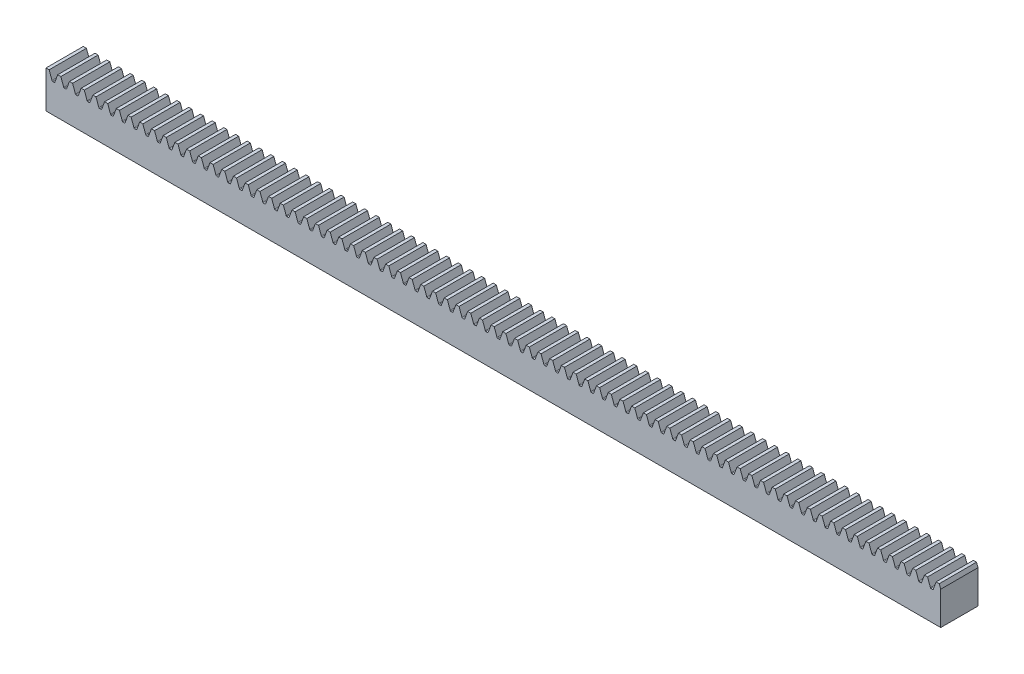
from build123d import *

# Parameters (mm, degrees)
SKETCH1_W           = 304.8
SKETCH1_H           = 12.7
BOSS_EXTRUDE1_DEPTH = 6.35
CUT_EXTRUDE1_DEPTH  = 12.7
FILLET3_R           = 0.254566605
LPATTERN4_START     = -6.35
LPATTERN4_DEPTH     = 12.7


# Read off the part's stored shape, not the designer's step: LPattern4
with BuildPart() as part:
    # Sketch1 → Boss-Extrude1 (new, symmetric)
    with BuildSketch(Plane.XY):
        Rectangle(SKETCH1_W, SKETCH1_H)
    extrude(amount=BOSS_EXTRUDE1_DEPTH, both=True)

    # Sketch2 → Cut-Extrude1 (cut)
    with BuildSketch(Plane.XY.offset(6.35)):
        Polygon((-151.329568395, 6.35), (-150.294145873, 3.5052), (-149.445590522, 3.5052), (-148.410168, 6.35), align=None)
    extrude(amount=-CUT_EXTRUDE1_DEPTH, mode=Mode.SUBTRACT)

    # Fillet3
    fillet3_edges = [part.edges().sort_by_distance(p)[0] for p in [
        (-149.445590522, 3.5052, 0),
        (-150.294145873, 3.5052, 0),
    ]]
    fillet(fillet3_edges, radius=FILLET3_R)

    # LPattern4 outline → LPattern4 (cut)
    with BuildSketch(Plane.XY.offset(LPATTERN4_START)):
        with BuildLine():
            ThreePointArc((-146.365278777, 3.672699698), (-146.272077823, 3.55123785), (-146.126064417, 3.5052))
            Line((-146.126064417, 3.5052), (-145.634007978, 3.5052))
            ThreePointArc((-145.634007978, 3.5052), (-145.487994572, 3.55123785), (-145.394793618, 3.672699698))
            Line((-145.394793618, 3.672699698), (-144.420336, 6.35))
            Line((-144.420336, 6.35), (-147.339736395, 6.35))
            Line((-147.339736395, 6.35), (-146.365278777, 3.672699698))
        make_face()
        Polygon((152.4, 6.35), (151.897663605, 6.35), (152.4, 4.969842098), align=None)
        with BuildLine():
            Line((150.827232, 6.35), (147.907831605, 6.35))
            Line((147.907831605, 6.35), (148.882289223, 3.672699698))
            ThreePointArc((148.882289223, 3.672699698), (148.975490177, 3.55123785), (149.121503583, 3.5052))
            Line((149.121503583, 3.5052), (149.613560022, 3.5052))
            ThreePointArc((149.613560022, 3.5052), (149.759573428, 3.55123785), (149.852774382, 3.672699698))
            Line((149.852774382, 3.672699698), (150.827232, 6.35))
        make_face()
        with BuildLine():
            Line((146.8374, 6.35), (143.917999605, 6.35))
            Line((143.917999605, 6.35), (144.892457223, 3.672699698))
            ThreePointArc((144.892457223, 3.672699698), (144.985658177, 3.55123785), (145.131671583, 3.5052))
            Line((145.131671583, 3.5052), (145.623728022, 3.5052))
            ThreePointArc((145.623728022, 3.5052), (145.769741428, 3.55123785), (145.862942382, 3.672699698))
            Line((145.862942382, 3.672699698), (146.8374, 6.35))
        make_face()
        with BuildLine():
            Line((142.847568, 6.35), (139.928167605, 6.35))
            Line((139.928167605, 6.35), (140.902625223, 3.672699698))
            ThreePointArc((140.902625223, 3.672699698), (140.995826177, 3.55123785), (141.141839583, 3.5052))
            Line((141.141839583, 3.5052), (141.633896022, 3.5052))
            ThreePointArc((141.633896022, 3.5052), (141.779909428, 3.55123785), (141.873110382, 3.672699698))
            Line((141.873110382, 3.672699698), (142.847568, 6.35))
        make_face()
        with BuildLine():
            Line((138.857736, 6.35), (135.938335605, 6.35))
            Line((135.938335605, 6.35), (136.912793223, 3.672699698))
            ThreePointArc((136.912793223, 3.672699698), (137.005994177, 3.55123785), (137.152007583, 3.5052))
            Line((137.152007583, 3.5052), (137.644064022, 3.5052))
            ThreePointArc((137.644064022, 3.5052), (137.790077428, 3.55123785), (137.883278382, 3.672699698))
            Line((137.883278382, 3.672699698), (138.857736, 6.35))
        make_face()
        with BuildLine():
            Line((134.867904, 6.35), (131.948503605, 6.35))
            Line((131.948503605, 6.35), (132.922961223, 3.672699698))
            ThreePointArc((132.922961223, 3.672699698), (133.016162177, 3.55123785), (133.162175583, 3.5052))
            Line((133.162175583, 3.5052), (133.654232022, 3.5052))
            ThreePointArc((133.654232022, 3.5052), (133.800245428, 3.55123785), (133.893446382, 3.672699698))
            Line((133.893446382, 3.672699698), (134.867904, 6.35))
        make_face()
        with BuildLine():
            Line((130.878072, 6.35), (127.958671605, 6.35))
            Line((127.958671605, 6.35), (128.933129223, 3.672699698))
            ThreePointArc((128.933129223, 3.672699698), (129.026330177, 3.55123785), (129.172343583, 3.5052))
            Line((129.172343583, 3.5052), (129.664400022, 3.5052))
            ThreePointArc((129.664400022, 3.5052), (129.810413428, 3.55123785), (129.903614382, 3.672699698))
            Line((129.903614382, 3.672699698), (130.878072, 6.35))
        make_face()
        with BuildLine():
            Line((126.88824, 6.35), (123.968839605, 6.35))
            Line((123.968839605, 6.35), (124.943297223, 3.672699698))
            ThreePointArc((124.943297223, 3.672699698), (125.036498177, 3.55123785), (125.182511583, 3.5052))
            Line((125.182511583, 3.5052), (125.674568022, 3.5052))
            ThreePointArc((125.674568022, 3.5052), (125.820581428, 3.55123785), (125.913782382, 3.672699698))
            Line((125.913782382, 3.672699698), (126.88824, 6.35))
        make_face()
        with BuildLine():
            Line((122.898408, 6.35), (119.979007605, 6.35))
            Line((119.979007605, 6.35), (120.953465223, 3.672699698))
            ThreePointArc((120.953465223, 3.672699698), (121.046666177, 3.55123785), (121.192679583, 3.5052))
            Line((121.192679583, 3.5052), (121.684736022, 3.5052))
            ThreePointArc((121.684736022, 3.5052), (121.830749428, 3.55123785), (121.923950382, 3.672699698))
            Line((121.923950382, 3.672699698), (122.898408, 6.35))
        make_face()
        with BuildLine():
            Line((118.908576, 6.35), (115.989175605, 6.35))
            Line((115.989175605, 6.35), (116.963633223, 3.672699698))
            ThreePointArc((116.963633223, 3.672699698), (117.056834177, 3.55123785), (117.202847583, 3.5052))
            Line((117.202847583, 3.5052), (117.694904022, 3.5052))
            ThreePointArc((117.694904022, 3.5052), (117.840917428, 3.55123785), (117.934118382, 3.672699698))
            Line((117.934118382, 3.672699698), (118.908576, 6.35))
        make_face()
        with BuildLine():
            Line((114.918744, 6.35), (111.999343605, 6.35))
            Line((111.999343605, 6.35), (112.973801223, 3.672699698))
            ThreePointArc((112.973801223, 3.672699698), (113.067002177, 3.55123785), (113.213015583, 3.5052))
            Line((113.213015583, 3.5052), (113.705072022, 3.5052))
            ThreePointArc((113.705072022, 3.5052), (113.851085428, 3.55123785), (113.944286382, 3.672699698))
            Line((113.944286382, 3.672699698), (114.918744, 6.35))
        make_face()
        with BuildLine():
            Line((110.928912, 6.35), (108.009511605, 6.35))
            Line((108.009511605, 6.35), (108.983969223, 3.672699698))
            ThreePointArc((108.983969223, 3.672699698), (109.077170177, 3.55123785), (109.223183583, 3.5052))
            Line((109.223183583, 3.5052), (109.715240022, 3.5052))
            ThreePointArc((109.715240022, 3.5052), (109.861253428, 3.55123785), (109.954454382, 3.672699698))
            Line((109.954454382, 3.672699698), (110.928912, 6.35))
        make_face()
        with BuildLine():
            Line((106.93908, 6.35), (104.019679605, 6.35))
            Line((104.019679605, 6.35), (104.994137223, 3.672699698))
            ThreePointArc((104.994137223, 3.672699698), (105.087338177, 3.55123785), (105.233351583, 3.5052))
            Line((105.233351583, 3.5052), (105.725408022, 3.5052))
            ThreePointArc((105.725408022, 3.5052), (105.871421428, 3.55123785), (105.964622382, 3.672699698))
            Line((105.964622382, 3.672699698), (106.93908, 6.35))
        make_face()
        with BuildLine():
            Line((102.949248, 6.35), (100.029847605, 6.35))
            Line((100.029847605, 6.35), (101.004305223, 3.672699698))
            ThreePointArc((101.004305223, 3.672699698), (101.097506177, 3.55123785), (101.243519583, 3.5052))
            Line((101.243519583, 3.5052), (101.735576022, 3.5052))
            ThreePointArc((101.735576022, 3.5052), (101.881589428, 3.55123785), (101.974790382, 3.672699698))
            Line((101.974790382, 3.672699698), (102.949248, 6.35))
        make_face()
        with BuildLine():
            Line((98.959416, 6.35), (96.040015605, 6.35))
            Line((96.040015605, 6.35), (97.014473223, 3.672699698))
            ThreePointArc((97.014473223, 3.672699698), (97.107674177, 3.55123785), (97.253687583, 3.5052))
            Line((97.253687583, 3.5052), (97.745744022, 3.5052))
            ThreePointArc((97.745744022, 3.5052), (97.891757428, 3.55123785), (97.984958382, 3.672699698))
            Line((97.984958382, 3.672699698), (98.959416, 6.35))
        make_face()
        with BuildLine():
            Line((94.969584, 6.35), (92.050183605, 6.35))
            Line((92.050183605, 6.35), (93.024641223, 3.672699698))
            ThreePointArc((93.024641223, 3.672699698), (93.117842177, 3.55123785), (93.263855583, 3.5052))
            Line((93.263855583, 3.5052), (93.755912022, 3.5052))
            ThreePointArc((93.755912022, 3.5052), (93.901925428, 3.55123785), (93.995126382, 3.672699698))
            Line((93.995126382, 3.672699698), (94.969584, 6.35))
        make_face()
        with BuildLine():
            Line((90.979752, 6.35), (88.060351605, 6.35))
            Line((88.060351605, 6.35), (89.034809223, 3.672699698))
            ThreePointArc((89.034809223, 3.672699698), (89.128010177, 3.55123785), (89.274023583, 3.5052))
            Line((89.274023583, 3.5052), (89.766080022, 3.5052))
            ThreePointArc((89.766080022, 3.5052), (89.912093428, 3.55123785), (90.005294382, 3.672699698))
            Line((90.005294382, 3.672699698), (90.979752, 6.35))
        make_face()
        with BuildLine():
            Line((86.98992, 6.35), (84.070519605, 6.35))
            Line((84.070519605, 6.35), (85.044977223, 3.672699698))
            ThreePointArc((85.044977223, 3.672699698), (85.138178177, 3.55123785), (85.284191583, 3.5052))
            Line((85.284191583, 3.5052), (85.776248022, 3.5052))
            ThreePointArc((85.776248022, 3.5052), (85.922261428, 3.55123785), (86.015462382, 3.672699698))
            Line((86.015462382, 3.672699698), (86.98992, 6.35))
        make_face()
        with BuildLine():
            Line((83.000088, 6.35), (80.080687605, 6.35))
            Line((80.080687605, 6.35), (81.055145223, 3.672699698))
            ThreePointArc((81.055145223, 3.672699698), (81.148346177, 3.55123785), (81.294359583, 3.5052))
            Line((81.294359583, 3.5052), (81.786416022, 3.5052))
            ThreePointArc((81.786416022, 3.5052), (81.932429428, 3.55123785), (82.025630382, 3.672699698))
            Line((82.025630382, 3.672699698), (83.000088, 6.35))
        make_face()
        with BuildLine():
            Line((79.010256, 6.35), (76.090855605, 6.35))
            Line((76.090855605, 6.35), (77.065313223, 3.672699698))
            ThreePointArc((77.065313223, 3.672699698), (77.158514177, 3.55123785), (77.304527583, 3.5052))
            Line((77.304527583, 3.5052), (77.796584022, 3.5052))
            ThreePointArc((77.796584022, 3.5052), (77.942597428, 3.55123785), (78.035798382, 3.672699698))
            Line((78.035798382, 3.672699698), (79.010256, 6.35))
        make_face()
        with BuildLine():
            Line((75.020424, 6.35), (72.101023605, 6.35))
            Line((72.101023605, 6.35), (73.075481223, 3.672699698))
            ThreePointArc((73.075481223, 3.672699698), (73.168682177, 3.55123785), (73.314695583, 3.5052))
            Line((73.314695583, 3.5052), (73.806752022, 3.5052))
            ThreePointArc((73.806752022, 3.5052), (73.952765428, 3.55123785), (74.045966382, 3.672699698))
            Line((74.045966382, 3.672699698), (75.020424, 6.35))
        make_face()
        with BuildLine():
            Line((71.030592, 6.35), (68.111191605, 6.35))
            Line((68.111191605, 6.35), (69.085649223, 3.672699698))
            ThreePointArc((69.085649223, 3.672699698), (69.178850177, 3.55123785), (69.324863583, 3.5052))
            Line((69.324863583, 3.5052), (69.816920022, 3.5052))
            ThreePointArc((69.816920022, 3.5052), (69.962933428, 3.55123785), (70.056134382, 3.672699698))
            Line((70.056134382, 3.672699698), (71.030592, 6.35))
        make_face()
        with BuildLine():
            Line((67.04076, 6.35), (64.121359605, 6.35))
            Line((64.121359605, 6.35), (65.095817223, 3.672699698))
            ThreePointArc((65.095817223, 3.672699698), (65.189018177, 3.55123785), (65.335031583, 3.5052))
            Line((65.335031583, 3.5052), (65.827088022, 3.5052))
            ThreePointArc((65.827088022, 3.5052), (65.973101428, 3.55123785), (66.066302382, 3.672699698))
            Line((66.066302382, 3.672699698), (67.04076, 6.35))
        make_face()
        with BuildLine():
            Line((63.050928, 6.35), (60.131527605, 6.35))
            Line((60.131527605, 6.35), (61.105985223, 3.672699698))
            ThreePointArc((61.105985223, 3.672699698), (61.199186177, 3.55123785), (61.345199583, 3.5052))
            Line((61.345199583, 3.5052), (61.837256022, 3.5052))
            ThreePointArc((61.837256022, 3.5052), (61.983269428, 3.55123785), (62.076470382, 3.672699698))
            Line((62.076470382, 3.672699698), (63.050928, 6.35))
        make_face()
        with BuildLine():
            Line((59.061096, 6.35), (56.141695605, 6.35))
            Line((56.141695605, 6.35), (57.116153223, 3.672699698))
            ThreePointArc((57.116153223, 3.672699698), (57.209354177, 3.55123785), (57.355367583, 3.5052))
            Line((57.355367583, 3.5052), (57.847424022, 3.5052))
            ThreePointArc((57.847424022, 3.5052), (57.993437428, 3.55123785), (58.086638382, 3.672699698))
            Line((58.086638382, 3.672699698), (59.061096, 6.35))
        make_face()
        with BuildLine():
            Line((55.071264, 6.35), (52.151863605, 6.35))
            Line((52.151863605, 6.35), (53.126321223, 3.672699698))
            ThreePointArc((53.126321223, 3.672699698), (53.219522177, 3.55123785), (53.365535583, 3.5052))
            Line((53.365535583, 3.5052), (53.857592022, 3.5052))
            ThreePointArc((53.857592022, 3.5052), (54.003605428, 3.55123785), (54.096806382, 3.672699698))
            Line((54.096806382, 3.672699698), (55.071264, 6.35))
        make_face()
        with BuildLine():
            Line((51.081432, 6.35), (48.162031605, 6.35))
            Line((48.162031605, 6.35), (49.136489223, 3.672699698))
            ThreePointArc((49.136489223, 3.672699698), (49.229690177, 3.55123785), (49.375703583, 3.5052))
            Line((49.375703583, 3.5052), (49.867760022, 3.5052))
            ThreePointArc((49.867760022, 3.5052), (50.013773428, 3.55123785), (50.106974382, 3.672699698))
            Line((50.106974382, 3.672699698), (51.081432, 6.35))
        make_face()
        with BuildLine():
            Line((47.0916, 6.35), (44.172199605, 6.35))
            Line((44.172199605, 6.35), (45.146657223, 3.672699698))
            ThreePointArc((45.146657223, 3.672699698), (45.239858177, 3.55123785), (45.385871583, 3.5052))
            Line((45.385871583, 3.5052), (45.877928022, 3.5052))
            ThreePointArc((45.877928022, 3.5052), (46.023941428, 3.55123785), (46.117142382, 3.672699698))
            Line((46.117142382, 3.672699698), (47.0916, 6.35))
        make_face()
        with BuildLine():
            Line((43.101768, 6.35), (40.182367605, 6.35))
            Line((40.182367605, 6.35), (41.156825223, 3.672699698))
            ThreePointArc((41.156825223, 3.672699698), (41.250026177, 3.55123785), (41.396039583, 3.5052))
            Line((41.396039583, 3.5052), (41.888096022, 3.5052))
            ThreePointArc((41.888096022, 3.5052), (42.034109428, 3.55123785), (42.127310382, 3.672699698))
            Line((42.127310382, 3.672699698), (43.101768, 6.35))
        make_face()
        with BuildLine():
            Line((39.111936, 6.35), (36.192535605, 6.35))
            Line((36.192535605, 6.35), (37.166993223, 3.672699698))
            ThreePointArc((37.166993223, 3.672699698), (37.260194177, 3.55123785), (37.406207583, 3.5052))
            Line((37.406207583, 3.5052), (37.898264022, 3.5052))
            ThreePointArc((37.898264022, 3.5052), (38.044277428, 3.55123785), (38.137478382, 3.672699698))
            Line((38.137478382, 3.672699698), (39.111936, 6.35))
        make_face()
        with BuildLine():
            Line((35.122104, 6.35), (32.202703605, 6.35))
            Line((32.202703605, 6.35), (33.177161223, 3.672699698))
            ThreePointArc((33.177161223, 3.672699698), (33.270362177, 3.55123785), (33.416375583, 3.5052))
            Line((33.416375583, 3.5052), (33.908432022, 3.5052))
            ThreePointArc((33.908432022, 3.5052), (34.054445428, 3.55123785), (34.147646382, 3.672699698))
            Line((34.147646382, 3.672699698), (35.122104, 6.35))
        make_face()
        with BuildLine():
            Line((31.132272, 6.35), (28.212871605, 6.35))
            Line((28.212871605, 6.35), (29.187329223, 3.672699698))
            ThreePointArc((29.187329223, 3.672699698), (29.280530177, 3.55123785), (29.426543583, 3.5052))
            Line((29.426543583, 3.5052), (29.918600022, 3.5052))
            ThreePointArc((29.918600022, 3.5052), (30.064613428, 3.55123785), (30.157814382, 3.672699698))
            Line((30.157814382, 3.672699698), (31.132272, 6.35))
        make_face()
        with BuildLine():
            Line((27.14244, 6.35), (24.223039605, 6.35))
            Line((24.223039605, 6.35), (25.197497223, 3.672699698))
            ThreePointArc((25.197497223, 3.672699698), (25.290698177, 3.55123785), (25.436711583, 3.5052))
            Line((25.436711583, 3.5052), (25.928768022, 3.5052))
            ThreePointArc((25.928768022, 3.5052), (26.074781428, 3.55123785), (26.167982382, 3.672699698))
            Line((26.167982382, 3.672699698), (27.14244, 6.35))
        make_face()
        with BuildLine():
            Line((23.152608, 6.35), (20.233207605, 6.35))
            Line((20.233207605, 6.35), (21.207665223, 3.672699698))
            ThreePointArc((21.207665223, 3.672699698), (21.300866177, 3.55123785), (21.446879583, 3.5052))
            Line((21.446879583, 3.5052), (21.938936022, 3.5052))
            ThreePointArc((21.938936022, 3.5052), (22.084949428, 3.55123785), (22.178150382, 3.672699698))
            Line((22.178150382, 3.672699698), (23.152608, 6.35))
        make_face()
        with BuildLine():
            Line((19.162776, 6.35), (16.243375605, 6.35))
            Line((16.243375605, 6.35), (17.217833223, 3.672699698))
            ThreePointArc((17.217833223, 3.672699698), (17.311034177, 3.55123785), (17.457047583, 3.5052))
            Line((17.457047583, 3.5052), (17.949104022, 3.5052))
            ThreePointArc((17.949104022, 3.5052), (18.095117428, 3.55123785), (18.188318382, 3.672699698))
            Line((18.188318382, 3.672699698), (19.162776, 6.35))
        make_face()
        with BuildLine():
            Line((15.172944, 6.35), (12.253543605, 6.35))
            Line((12.253543605, 6.35), (13.228001223, 3.672699698))
            ThreePointArc((13.228001223, 3.672699698), (13.321202177, 3.55123785), (13.467215583, 3.5052))
            Line((13.467215583, 3.5052), (13.959272022, 3.5052))
            ThreePointArc((13.959272022, 3.5052), (14.105285428, 3.55123785), (14.198486382, 3.672699698))
            Line((14.198486382, 3.672699698), (15.172944, 6.35))
        make_face()
        with BuildLine():
            Line((11.183112, 6.35), (8.263711605, 6.35))
            Line((8.263711605, 6.35), (9.238169223, 3.672699698))
            ThreePointArc((9.238169223, 3.672699698), (9.331370177, 3.55123785), (9.477383583, 3.5052))
            Line((9.477383583, 3.5052), (9.969440022, 3.5052))
            ThreePointArc((9.969440022, 3.5052), (10.115453428, 3.55123785), (10.208654382, 3.672699698))
            Line((10.208654382, 3.672699698), (11.183112, 6.35))
        make_face()
        with BuildLine():
            Line((7.19328, 6.35), (4.273879605, 6.35))
            Line((4.273879605, 6.35), (5.248337223, 3.672699698))
            ThreePointArc((5.248337223, 3.672699698), (5.341538177, 3.55123785), (5.487551583, 3.5052))
            Line((5.487551583, 3.5052), (5.979608022, 3.5052))
            ThreePointArc((5.979608022, 3.5052), (6.125621428, 3.55123785), (6.218822382, 3.672699698))
            Line((6.218822382, 3.672699698), (7.19328, 6.35))
        make_face()
        with BuildLine():
            Line((3.203448, 6.35), (0.284047605, 6.35))
            Line((0.284047605, 6.35), (1.258505223, 3.672699698))
            ThreePointArc((1.258505223, 3.672699698), (1.351706177, 3.55123785), (1.497719583, 3.5052))
            Line((1.497719583, 3.5052), (1.989776022, 3.5052))
            ThreePointArc((1.989776022, 3.5052), (2.135789428, 3.55123785), (2.228990382, 3.672699698))
            Line((2.228990382, 3.672699698), (3.203448, 6.35))
        make_face()
        with BuildLine():
            Line((-0.786384, 6.35), (-3.705784395, 6.35))
            Line((-3.705784395, 6.35), (-2.731326777, 3.672699698))
            ThreePointArc((-2.731326777, 3.672699698), (-2.638125823, 3.55123785), (-2.492112417, 3.5052))
            Line((-2.492112417, 3.5052), (-2.000055978, 3.5052))
            ThreePointArc((-2.000055978, 3.5052), (-1.854042572, 3.55123785), (-1.760841618, 3.672699698))
            Line((-1.760841618, 3.672699698), (-0.786384, 6.35))
        make_face()
        with BuildLine():
            Line((-4.776216, 6.35), (-7.695616395, 6.35))
            Line((-7.695616395, 6.35), (-6.721158777, 3.672699698))
            ThreePointArc((-6.721158777, 3.672699698), (-6.627957823, 3.55123785), (-6.481944417, 3.5052))
            Line((-6.481944417, 3.5052), (-5.989887978, 3.5052))
            ThreePointArc((-5.989887978, 3.5052), (-5.843874572, 3.55123785), (-5.750673618, 3.672699698))
            Line((-5.750673618, 3.672699698), (-4.776216, 6.35))
        make_face()
        with BuildLine():
            Line((-8.766048, 6.35), (-11.685448395, 6.35))
            Line((-11.685448395, 6.35), (-10.710990777, 3.672699698))
            ThreePointArc((-10.710990777, 3.672699698), (-10.617789823, 3.55123785), (-10.471776417, 3.5052))
            Line((-10.471776417, 3.5052), (-9.979719978, 3.5052))
            ThreePointArc((-9.979719978, 3.5052), (-9.833706572, 3.55123785), (-9.740505618, 3.672699698))
            Line((-9.740505618, 3.672699698), (-8.766048, 6.35))
        make_face()
        with BuildLine():
            Line((-12.75588, 6.35), (-15.675280395, 6.35))
            Line((-15.675280395, 6.35), (-14.700822777, 3.672699698))
            ThreePointArc((-14.700822777, 3.672699698), (-14.607621823, 3.55123785), (-14.461608417, 3.5052))
            Line((-14.461608417, 3.5052), (-13.969551978, 3.5052))
            ThreePointArc((-13.969551978, 3.5052), (-13.823538572, 3.55123785), (-13.730337618, 3.672699698))
            Line((-13.730337618, 3.672699698), (-12.75588, 6.35))
        make_face()
        with BuildLine():
            Line((-16.745712, 6.35), (-19.665112395, 6.35))
            Line((-19.665112395, 6.35), (-18.690654777, 3.672699698))
            ThreePointArc((-18.690654777, 3.672699698), (-18.597453823, 3.55123785), (-18.451440417, 3.5052))
            Line((-18.451440417, 3.5052), (-17.959383978, 3.5052))
            ThreePointArc((-17.959383978, 3.5052), (-17.813370572, 3.55123785), (-17.720169618, 3.672699698))
            Line((-17.720169618, 3.672699698), (-16.745712, 6.35))
        make_face()
        with BuildLine():
            Line((-20.735544, 6.35), (-23.654944395, 6.35))
            Line((-23.654944395, 6.35), (-22.680486777, 3.672699698))
            ThreePointArc((-22.680486777, 3.672699698), (-22.587285823, 3.55123785), (-22.441272417, 3.5052))
            Line((-22.441272417, 3.5052), (-21.949215978, 3.5052))
            ThreePointArc((-21.949215978, 3.5052), (-21.803202572, 3.55123785), (-21.710001618, 3.672699698))
            Line((-21.710001618, 3.672699698), (-20.735544, 6.35))
        make_face()
        with BuildLine():
            Line((-24.725376, 6.35), (-27.644776395, 6.35))
            Line((-27.644776395, 6.35), (-26.670318777, 3.672699698))
            ThreePointArc((-26.670318777, 3.672699698), (-26.577117823, 3.55123785), (-26.431104417, 3.5052))
            Line((-26.431104417, 3.5052), (-25.939047978, 3.5052))
            ThreePointArc((-25.939047978, 3.5052), (-25.793034572, 3.55123785), (-25.699833618, 3.672699698))
            Line((-25.699833618, 3.672699698), (-24.725376, 6.35))
        make_face()
        with BuildLine():
            Line((-28.715208, 6.35), (-31.634608395, 6.35))
            Line((-31.634608395, 6.35), (-30.660150777, 3.672699698))
            ThreePointArc((-30.660150777, 3.672699698), (-30.566949823, 3.55123785), (-30.420936417, 3.5052))
            Line((-30.420936417, 3.5052), (-29.928879978, 3.5052))
            ThreePointArc((-29.928879978, 3.5052), (-29.782866572, 3.55123785), (-29.689665618, 3.672699698))
            Line((-29.689665618, 3.672699698), (-28.715208, 6.35))
        make_face()
        with BuildLine():
            Line((-32.70504, 6.35), (-35.624440395, 6.35))
            Line((-35.624440395, 6.35), (-34.649982777, 3.672699698))
            ThreePointArc((-34.649982777, 3.672699698), (-34.556781823, 3.55123785), (-34.410768417, 3.5052))
            Line((-34.410768417, 3.5052), (-33.918711978, 3.5052))
            ThreePointArc((-33.918711978, 3.5052), (-33.772698572, 3.55123785), (-33.679497618, 3.672699698))
            Line((-33.679497618, 3.672699698), (-32.70504, 6.35))
        make_face()
        with BuildLine():
            Line((-36.694872, 6.35), (-39.614272395, 6.35))
            Line((-39.614272395, 6.35), (-38.639814777, 3.672699698))
            ThreePointArc((-38.639814777, 3.672699698), (-38.546613823, 3.55123785), (-38.400600417, 3.5052))
            Line((-38.400600417, 3.5052), (-37.908543978, 3.5052))
            ThreePointArc((-37.908543978, 3.5052), (-37.762530572, 3.55123785), (-37.669329618, 3.672699698))
            Line((-37.669329618, 3.672699698), (-36.694872, 6.35))
        make_face()
        with BuildLine():
            Line((-40.684704, 6.35), (-43.604104395, 6.35))
            Line((-43.604104395, 6.35), (-42.629646777, 3.672699698))
            ThreePointArc((-42.629646777, 3.672699698), (-42.536445823, 3.55123785), (-42.390432417, 3.5052))
            Line((-42.390432417, 3.5052), (-41.898375978, 3.5052))
            ThreePointArc((-41.898375978, 3.5052), (-41.752362572, 3.55123785), (-41.659161618, 3.672699698))
            Line((-41.659161618, 3.672699698), (-40.684704, 6.35))
        make_face()
        with BuildLine():
            Line((-44.674536, 6.35), (-47.593936395, 6.35))
            Line((-47.593936395, 6.35), (-46.619478777, 3.672699698))
            ThreePointArc((-46.619478777, 3.672699698), (-46.526277823, 3.55123785), (-46.380264417, 3.5052))
            Line((-46.380264417, 3.5052), (-45.888207978, 3.5052))
            ThreePointArc((-45.888207978, 3.5052), (-45.742194572, 3.55123785), (-45.648993618, 3.672699698))
            Line((-45.648993618, 3.672699698), (-44.674536, 6.35))
        make_face()
        with BuildLine():
            Line((-48.664368, 6.35), (-51.583768395, 6.35))
            Line((-51.583768395, 6.35), (-50.609310777, 3.672699698))
            ThreePointArc((-50.609310777, 3.672699698), (-50.516109823, 3.55123785), (-50.370096417, 3.5052))
            Line((-50.370096417, 3.5052), (-49.878039978, 3.5052))
            ThreePointArc((-49.878039978, 3.5052), (-49.732026572, 3.55123785), (-49.638825618, 3.672699698))
            Line((-49.638825618, 3.672699698), (-48.664368, 6.35))
        make_face()
        with BuildLine():
            Line((-52.6542, 6.35), (-55.573600395, 6.35))
            Line((-55.573600395, 6.35), (-54.599142777, 3.672699698))
            ThreePointArc((-54.599142777, 3.672699698), (-54.505941823, 3.55123785), (-54.359928417, 3.5052))
            Line((-54.359928417, 3.5052), (-53.867871978, 3.5052))
            ThreePointArc((-53.867871978, 3.5052), (-53.721858572, 3.55123785), (-53.628657618, 3.672699698))
            Line((-53.628657618, 3.672699698), (-52.6542, 6.35))
        make_face()
        with BuildLine():
            Line((-56.644032, 6.35), (-59.563432395, 6.35))
            Line((-59.563432395, 6.35), (-58.588974777, 3.672699698))
            ThreePointArc((-58.588974777, 3.672699698), (-58.495773823, 3.55123785), (-58.349760417, 3.5052))
            Line((-58.349760417, 3.5052), (-57.857703978, 3.5052))
            ThreePointArc((-57.857703978, 3.5052), (-57.711690572, 3.55123785), (-57.618489618, 3.672699698))
            Line((-57.618489618, 3.672699698), (-56.644032, 6.35))
        make_face()
        with BuildLine():
            Line((-60.633864, 6.35), (-63.553264395, 6.35))
            Line((-63.553264395, 6.35), (-62.578806777, 3.672699698))
            ThreePointArc((-62.578806777, 3.672699698), (-62.485605823, 3.55123785), (-62.339592417, 3.5052))
            Line((-62.339592417, 3.5052), (-61.847535978, 3.5052))
            ThreePointArc((-61.847535978, 3.5052), (-61.701522572, 3.55123785), (-61.608321618, 3.672699698))
            Line((-61.608321618, 3.672699698), (-60.633864, 6.35))
        make_face()
        with BuildLine():
            Line((-64.623696, 6.35), (-67.543096395, 6.35))
            Line((-67.543096395, 6.35), (-66.568638777, 3.672699698))
            ThreePointArc((-66.568638777, 3.672699698), (-66.475437823, 3.55123785), (-66.329424417, 3.5052))
            Line((-66.329424417, 3.5052), (-65.837367978, 3.5052))
            ThreePointArc((-65.837367978, 3.5052), (-65.691354572, 3.55123785), (-65.598153618, 3.672699698))
            Line((-65.598153618, 3.672699698), (-64.623696, 6.35))
        make_face()
        with BuildLine():
            Line((-68.613528, 6.35), (-71.532928395, 6.35))
            Line((-71.532928395, 6.35), (-70.558470777, 3.672699698))
            ThreePointArc((-70.558470777, 3.672699698), (-70.465269823, 3.55123785), (-70.319256417, 3.5052))
            Line((-70.319256417, 3.5052), (-69.827199978, 3.5052))
            ThreePointArc((-69.827199978, 3.5052), (-69.681186572, 3.55123785), (-69.587985618, 3.672699698))
            Line((-69.587985618, 3.672699698), (-68.613528, 6.35))
        make_face()
        with BuildLine():
            Line((-72.60336, 6.35), (-75.522760395, 6.35))
            Line((-75.522760395, 6.35), (-74.548302777, 3.672699698))
            ThreePointArc((-74.548302777, 3.672699698), (-74.455101823, 3.55123785), (-74.309088417, 3.5052))
            Line((-74.309088417, 3.5052), (-73.817031978, 3.5052))
            ThreePointArc((-73.817031978, 3.5052), (-73.671018572, 3.55123785), (-73.577817618, 3.672699698))
            Line((-73.577817618, 3.672699698), (-72.60336, 6.35))
        make_face()
        with BuildLine():
            Line((-76.593192, 6.35), (-79.512592395, 6.35))
            Line((-79.512592395, 6.35), (-78.538134777, 3.672699698))
            ThreePointArc((-78.538134777, 3.672699698), (-78.444933823, 3.55123785), (-78.298920417, 3.5052))
            Line((-78.298920417, 3.5052), (-77.806863978, 3.5052))
            ThreePointArc((-77.806863978, 3.5052), (-77.660850572, 3.55123785), (-77.567649618, 3.672699698))
            Line((-77.567649618, 3.672699698), (-76.593192, 6.35))
        make_face()
        with BuildLine():
            Line((-80.583024, 6.35), (-83.502424395, 6.35))
            Line((-83.502424395, 6.35), (-82.527966777, 3.672699698))
            ThreePointArc((-82.527966777, 3.672699698), (-82.434765823, 3.55123785), (-82.288752417, 3.5052))
            Line((-82.288752417, 3.5052), (-81.796695978, 3.5052))
            ThreePointArc((-81.796695978, 3.5052), (-81.650682572, 3.55123785), (-81.557481618, 3.672699698))
            Line((-81.557481618, 3.672699698), (-80.583024, 6.35))
        make_face()
        with BuildLine():
            Line((-84.572856, 6.35), (-87.492256395, 6.35))
            Line((-87.492256395, 6.35), (-86.517798777, 3.672699698))
            ThreePointArc((-86.517798777, 3.672699698), (-86.424597823, 3.55123785), (-86.278584417, 3.5052))
            Line((-86.278584417, 3.5052), (-85.786527978, 3.5052))
            ThreePointArc((-85.786527978, 3.5052), (-85.640514572, 3.55123785), (-85.547313618, 3.672699698))
            Line((-85.547313618, 3.672699698), (-84.572856, 6.35))
        make_face()
        with BuildLine():
            Line((-88.562688, 6.35), (-91.482088395, 6.35))
            Line((-91.482088395, 6.35), (-90.507630777, 3.672699698))
            ThreePointArc((-90.507630777, 3.672699698), (-90.414429823, 3.55123785), (-90.268416417, 3.5052))
            Line((-90.268416417, 3.5052), (-89.776359978, 3.5052))
            ThreePointArc((-89.776359978, 3.5052), (-89.630346572, 3.55123785), (-89.537145618, 3.672699698))
            Line((-89.537145618, 3.672699698), (-88.562688, 6.35))
        make_face()
        with BuildLine():
            Line((-92.55252, 6.35), (-95.471920395, 6.35))
            Line((-95.471920395, 6.35), (-94.497462777, 3.672699698))
            ThreePointArc((-94.497462777, 3.672699698), (-94.404261823, 3.55123785), (-94.258248417, 3.5052))
            Line((-94.258248417, 3.5052), (-93.766191978, 3.5052))
            ThreePointArc((-93.766191978, 3.5052), (-93.620178572, 3.55123785), (-93.526977618, 3.672699698))
            Line((-93.526977618, 3.672699698), (-92.55252, 6.35))
        make_face()
        with BuildLine():
            Line((-96.542352, 6.35), (-99.461752395, 6.35))
            Line((-99.461752395, 6.35), (-98.487294777, 3.672699698))
            ThreePointArc((-98.487294777, 3.672699698), (-98.394093823, 3.55123785), (-98.248080417, 3.5052))
            Line((-98.248080417, 3.5052), (-97.756023978, 3.5052))
            ThreePointArc((-97.756023978, 3.5052), (-97.610010572, 3.55123785), (-97.516809618, 3.672699698))
            Line((-97.516809618, 3.672699698), (-96.542352, 6.35))
        make_face()
        with BuildLine():
            Line((-100.532184, 6.35), (-103.451584395, 6.35))
            Line((-103.451584395, 6.35), (-102.477126777, 3.672699698))
            ThreePointArc((-102.477126777, 3.672699698), (-102.383925823, 3.55123785), (-102.237912417, 3.5052))
            Line((-102.237912417, 3.5052), (-101.745855978, 3.5052))
            ThreePointArc((-101.745855978, 3.5052), (-101.599842572, 3.55123785), (-101.506641618, 3.672699698))
            Line((-101.506641618, 3.672699698), (-100.532184, 6.35))
        make_face()
        with BuildLine():
            Line((-104.522016, 6.35), (-107.441416395, 6.35))
            Line((-107.441416395, 6.35), (-106.466958777, 3.672699698))
            ThreePointArc((-106.466958777, 3.672699698), (-106.373757823, 3.55123785), (-106.227744417, 3.5052))
            Line((-106.227744417, 3.5052), (-105.735687978, 3.5052))
            ThreePointArc((-105.735687978, 3.5052), (-105.589674572, 3.55123785), (-105.496473618, 3.672699698))
            Line((-105.496473618, 3.672699698), (-104.522016, 6.35))
        make_face()
        with BuildLine():
            Line((-108.511848, 6.35), (-111.431248395, 6.35))
            Line((-111.431248395, 6.35), (-110.456790777, 3.672699698))
            ThreePointArc((-110.456790777, 3.672699698), (-110.363589823, 3.55123785), (-110.217576417, 3.5052))
            Line((-110.217576417, 3.5052), (-109.725519978, 3.5052))
            ThreePointArc((-109.725519978, 3.5052), (-109.579506572, 3.55123785), (-109.486305618, 3.672699698))
            Line((-109.486305618, 3.672699698), (-108.511848, 6.35))
        make_face()
        with BuildLine():
            Line((-112.50168, 6.35), (-115.421080395, 6.35))
            Line((-115.421080395, 6.35), (-114.446622777, 3.672699698))
            ThreePointArc((-114.446622777, 3.672699698), (-114.353421823, 3.55123785), (-114.207408417, 3.5052))
            Line((-114.207408417, 3.5052), (-113.715351978, 3.5052))
            ThreePointArc((-113.715351978, 3.5052), (-113.569338572, 3.55123785), (-113.476137618, 3.672699698))
            Line((-113.476137618, 3.672699698), (-112.50168, 6.35))
        make_face()
        with BuildLine():
            Line((-116.491512, 6.35), (-119.410912395, 6.35))
            Line((-119.410912395, 6.35), (-118.436454777, 3.672699698))
            ThreePointArc((-118.436454777, 3.672699698), (-118.343253823, 3.55123785), (-118.197240417, 3.5052))
            Line((-118.197240417, 3.5052), (-117.705183978, 3.5052))
            ThreePointArc((-117.705183978, 3.5052), (-117.559170572, 3.55123785), (-117.465969618, 3.672699698))
            Line((-117.465969618, 3.672699698), (-116.491512, 6.35))
        make_face()
        with BuildLine():
            Line((-120.481344, 6.35), (-123.400744395, 6.35))
            Line((-123.400744395, 6.35), (-122.426286777, 3.672699698))
            ThreePointArc((-122.426286777, 3.672699698), (-122.333085823, 3.55123785), (-122.187072417, 3.5052))
            Line((-122.187072417, 3.5052), (-121.695015978, 3.5052))
            ThreePointArc((-121.695015978, 3.5052), (-121.549002572, 3.55123785), (-121.455801618, 3.672699698))
            Line((-121.455801618, 3.672699698), (-120.481344, 6.35))
        make_face()
        with BuildLine():
            Line((-124.471176, 6.35), (-127.390576395, 6.35))
            Line((-127.390576395, 6.35), (-126.416118777, 3.672699698))
            ThreePointArc((-126.416118777, 3.672699698), (-126.322917823, 3.55123785), (-126.176904417, 3.5052))
            Line((-126.176904417, 3.5052), (-125.684847978, 3.5052))
            ThreePointArc((-125.684847978, 3.5052), (-125.538834572, 3.55123785), (-125.445633618, 3.672699698))
            Line((-125.445633618, 3.672699698), (-124.471176, 6.35))
        make_face()
        with BuildLine():
            Line((-128.461008, 6.35), (-131.380408395, 6.35))
            Line((-131.380408395, 6.35), (-130.405950777, 3.672699698))
            ThreePointArc((-130.405950777, 3.672699698), (-130.312749823, 3.55123785), (-130.166736417, 3.5052))
            Line((-130.166736417, 3.5052), (-129.674679978, 3.5052))
            ThreePointArc((-129.674679978, 3.5052), (-129.528666572, 3.55123785), (-129.435465618, 3.672699698))
            Line((-129.435465618, 3.672699698), (-128.461008, 6.35))
        make_face()
        with BuildLine():
            Line((-132.45084, 6.35), (-135.370240395, 6.35))
            Line((-135.370240395, 6.35), (-134.395782777, 3.672699698))
            ThreePointArc((-134.395782777, 3.672699698), (-134.302581823, 3.55123785), (-134.156568417, 3.5052))
            Line((-134.156568417, 3.5052), (-133.664511978, 3.5052))
            ThreePointArc((-133.664511978, 3.5052), (-133.518498572, 3.55123785), (-133.425297618, 3.672699698))
            Line((-133.425297618, 3.672699698), (-132.45084, 6.35))
        make_face()
        with BuildLine():
            Line((-136.440672, 6.35), (-139.360072395, 6.35))
            Line((-139.360072395, 6.35), (-138.385614777, 3.672699698))
            ThreePointArc((-138.385614777, 3.672699698), (-138.292413823, 3.55123785), (-138.146400417, 3.5052))
            Line((-138.146400417, 3.5052), (-137.654343978, 3.5052))
            ThreePointArc((-137.654343978, 3.5052), (-137.508330572, 3.55123785), (-137.415129618, 3.672699698))
            Line((-137.415129618, 3.672699698), (-136.440672, 6.35))
        make_face()
        with BuildLine():
            Line((-140.430504, 6.35), (-143.349904395, 6.35))
            Line((-143.349904395, 6.35), (-142.375446777, 3.672699698))
            ThreePointArc((-142.375446777, 3.672699698), (-142.282245823, 3.55123785), (-142.136232417, 3.5052))
            Line((-142.136232417, 3.5052), (-141.644175978, 3.5052))
            ThreePointArc((-141.644175978, 3.5052), (-141.498162572, 3.55123785), (-141.404961618, 3.672699698))
            Line((-141.404961618, 3.672699698), (-140.430504, 6.35))
        make_face()
    extrude(amount=LPATTERN4_DEPTH, mode=Mode.SUBTRACT)


solid = part.part
